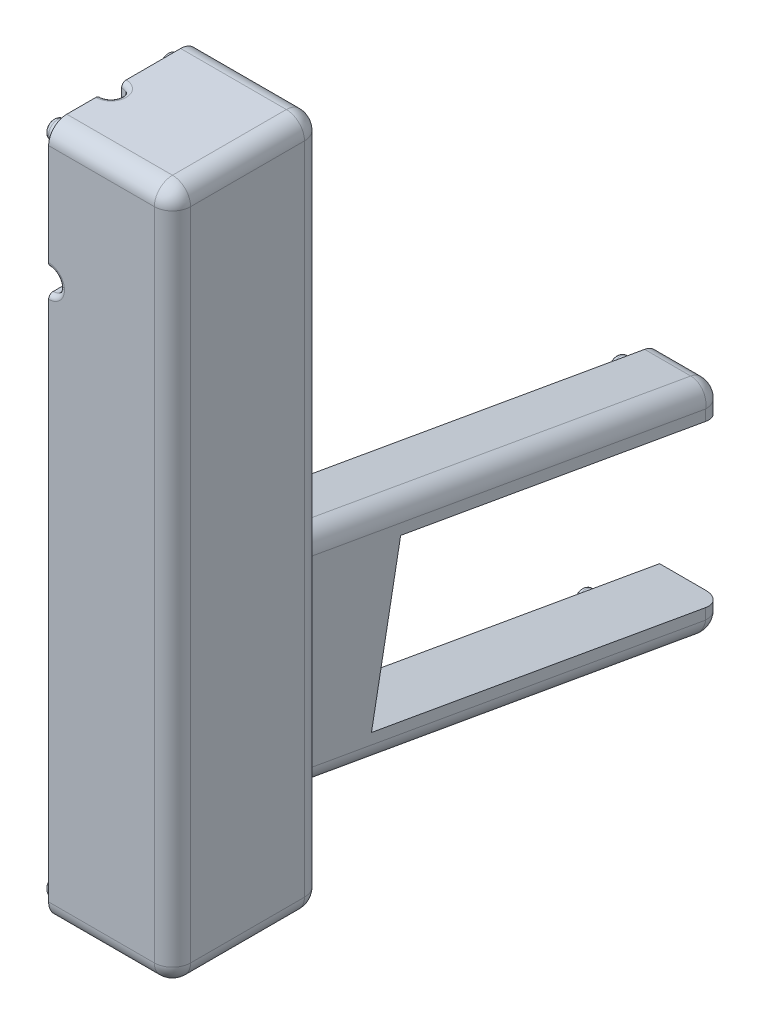
from build123d import *

# Parameters (mm, degrees)
SKETCH1_W                = 27.305
SKETCH1_H                = 33.1
BOSS_EXTRUDE1_DEPTH      = 152.4
SKETCH2_W                = 20.4
SKETCH2_H                = 139.7
CUT_EXTRUDE1_DEPTH       = 19.05
HITLED_REACH             = 160.325
SKETCH6_W                = 6.35
SKETCH6_H                = 74.93
PCB_DEPTH                = 6.35
SKETCH16_R               = 2
PRESSFIT_DEPTH           = 3
FILLET_PRESSFIT_R        = 1
BUTT_DEPTH               = 14.175
BATTERYPACK_DEPTH        = 14.175
SKETCH22_R               = 2
PRESSFIT_BOTTOM_DEPTH    = 3
IRLED_REACH              = 206.379
FILLET_BODY_R            = 4
FILLET_PRESSFIT_BOTTOM_R = 1
FILLET_LED_S_R           = 1
CUT_EXTRUDE2_DEPTH       = 3.5
CUT_EXTRUDE3_DEPTH       = 12.065
CUT_EXTRUDE4_DEPTH       = 7.825


with BuildPart() as part:
    # Sketch1 → Boss-Extrude1 (new body)
    with BuildSketch(Plane(origin=(0, 0, 0), x_dir=(1, 0, 0), z_dir=(0, 1, 0))):
        with Locations((13.6525, 16.55)):
            Rectangle(SKETCH1_W, SKETCH1_H)
    extrude(amount=BOSS_EXTRUDE1_DEPTH)

    # Sketch2 → Cut-Extrude1 (cut)
    with BuildSketch(Plane.ZY):
        with Locations((-16.55, 76.2)):
            Rectangle(SKETCH2_W, SKETCH2_H)
    extrude(amount=-CUT_EXTRUDE1_DEPTH, mode=Mode.SUBTRACT)

    # Sketch3 → HitLED (cut, up to next)
    with BuildSketch(Plane.XY, mode=Mode.PRIVATE) as hitled_sk1:
        with BuildLine():
            Line((0, 125.055), (0, 120.055))
            ThreePointArc((0, 120.055), (2.5, 122.555), (0, 125.055))
        make_face()
    hitled_tool1 = extrude(hitled_sk1.sketch, amount=-HITLED_REACH, mode=Mode.PRIVATE) & part.part
    add(hitled_tool1.solids().sort_by_distance((1.061033, 122.555, 0))[0], mode=Mode.SUBTRACT)

    # Sketch6 → PCB (add)
    with BuildSketch(Plane.ZY.offset(-19.05)):
        with Locations((-12.525, 70.485)):
            Rectangle(SKETCH6_W, SKETCH6_H)
        with Locations((-20.575, 70.485)):
            Rectangle(SKETCH6_W, SKETCH6_H)
    extrude(amount=PCB_DEPTH)

    # Sketch16 → PressFit (add)
    with BuildSketch(Plane.ZY):
        with Locations((-4, 148.4)):
            Circle(SKETCH16_R)
        with Locations((-4, 4)):
            Circle(SKETCH16_R)
        with Locations((-29.1, 148.4)):
            Circle(SKETCH16_R)
        with Locations((-29.1, 4)):
            Circle(SKETCH16_R)
    extrude(amount=PRESSFIT_DEPTH)

    # Fillet-PressFit
    fillet_pressfit_edges = [part.edges().sort_by_distance(p)[0] for p in [
        (-3, 4, -31.1),
        (-3, 4, -6),
        (-3, 148.4, -31.1),
        (-3, 148.4, -6),
    ]]
    fillet(fillet_pressfit_edges, radius=FILLET_PRESSFIT_R)

    # Sketch23 → Butt (add)
    with BuildSketch(Plane(origin=(0, 0, -25.4), x_dir=(0, 0, 1), z_dir=(-1, 0, 0))):
        Polygon((-7.7, 61.135849387), (-7.7, 12.7), (-109.3, -5.21482124), (-109.3, 43.221028147), align=None)
    extrude(amount=-BUTT_DEPTH)

    # Sketch20 → BatteryPack (cut)
    with BuildSketch(Plane.ZY):
        Polygon((-63.435596448, 49.338906272), (-57.003300004, 14.933162267), (-123.973771116, 3.124461299), (-134.7, 1.233137745), (-134.7, 36.773069161), (-130.40606756, 37.530205304), align=None)
    extrude(amount=-BATTERYPACK_DEPTH, mode=Mode.SUBTRACT)

    # Sketch22 → PressFit - Bottom (add)
    with BuildSketch(Plane.ZY):
        with Locations((-128.066987256, 41.166627764)):
            Circle(SKETCH22_R)
        with Locations((-120.442926047, 0.523065057)):
            Circle(SKETCH22_R)
    extrude(amount=PRESSFIT_BOTTOM_DEPTH)

    # Sketch25 → IRLED (cut, up to next)
    with BuildSketch(Plane.XZ.offset(-146.05), mode=Mode.PRIVATE) as irled_sk1:
        with BuildLine():
            Line((0, -11.4), (0, -16.1))
            ThreePointArc((0, -16.1), (2.35, -13.75), (0, -11.4))
        make_face()
    irled_tool1 = extrude(irled_sk1.sketch, amount=-IRLED_REACH, mode=Mode.PRIVATE) & part.part
    add(irled_tool1.solids().sort_by_distance((0.997371, 146.05, -13.75))[0], mode=Mode.SUBTRACT)

    # Fillet - Body
    fillet_body_edges = [part.edges().sort_by_distance(p)[0] for p in [
        (14.175, -1.990841747, -134.7),
        (14.175, 39.997048654, -134.7),
        (7.0875, 43.221028147, -134.7),
        (7.0875, -5.21482124, -134.7),
        (14.175, 52.178438767, -83.9),
        (14.175, 3.74258938, -83.9),
        (7.0875, 12.7, -33.1),
        (14.175, 36.917924693, -33.1),
        (7.0875, 61.135849387, -33.1),
        (13.6525, 152.4, -33.1),
        (13.6525, 152.4, 0),
        (27.305, 152.4, -16.55),
        (27.305, 76.2, -33.1),
        (27.305, 0, -16.55),
        (13.6525, 0, -33.1),
        (13.6525, 0, 0),
        (27.305, 76.2, 0),
    ]]
    fillet(fillet_body_edges, radius=FILLET_BODY_R)

    # Fillet-PressFit-Bottom
    fillet_pressfit_bottom_edges = [part.edges().sort_by_distance(p)[0] for p in [
        (-3, 0.523065057, -122.442926047),
        (-3, 41.166627764, -130.066987256),
    ]]
    fillet(fillet_pressfit_bottom_edges, radius=FILLET_PRESSFIT_BOTTOM_R)

    # Fillet-LED's
    fillet_led_s_edges = [part.edges().sort_by_distance(p)[0] for p in [
        (2.35, 152.4, -13.75),
        (2.5, 122.555, 0),
    ]]
    fillet(fillet_led_s_edges, radius=FILLET_LED_S_R)

    # Sketch26 → Cut-Extrude2 (cut)
    with BuildSketch(Plane.ZY):
        Polygon((-46.717974009, 58.734633147), (-53.61162828, 57.519095903), (-52.986494841, 53.973787992), (-46.09284057, 55.189325236), align=None)
    extrude(amount=-CUT_EXTRUDE2_DEPTH, mode=Mode.SUBTRACT)

    # Sketch27 → Cut-Extrude3 (cut)
    with BuildSketch(Plane.ZY):
        Polygon((-40.159373858, 56.235555506), (-58.919961553, 52.927557722), (-58.62475965, 51.253384541), (-39.864171956, 54.561382326), align=None)
    extrude(amount=-CUT_EXTRUDE3_DEPTH, mode=Mode.SUBTRACT)

    # Sketch28 → Cut-Extrude4 (cut)
    with BuildSketch(Plane.ZY):
        Polygon((-46.290042544, 53.428327967), (-52.198889062, 52.386438901), (-47.85768462, 27.766245075), (-41.948838102, 28.808134141), align=None)
    extrude(amount=-CUT_EXTRUDE4_DEPTH, mode=Mode.SUBTRACT)


solid = part.part
